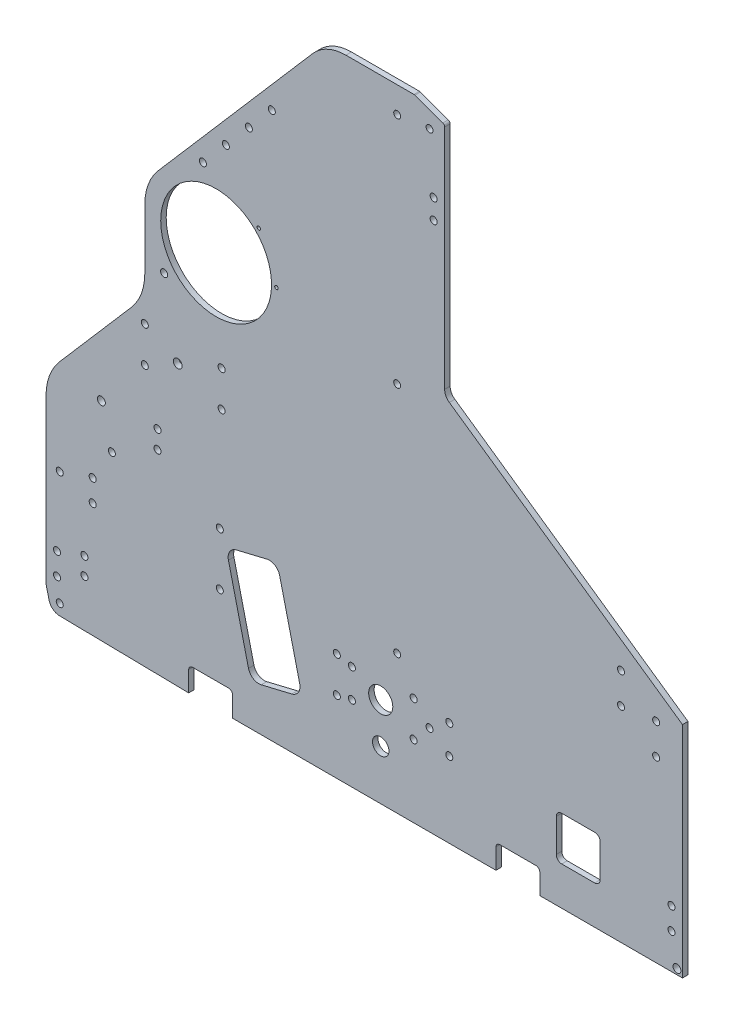
from build123d import *

# Parameters (mm, degrees)
SKETCH1_R           = 2.032
SKETCH1_R_2         = 2.54
SKETCH1_R_3         = 2
BOSS_EXTRUDE1_DEPTH = 3.175
FILLET1_R           = 2.286
FILLET2_R           = 6.35
SKETCH2_R           = 2.032
CUT_EXTRUDE1_DEPTH  = 505.524983177
FILLET3_R           = 1.5875
SKETCH3_R           = 2.032
SKETCH3_R_2         = 2.286
SKETCH3_R_3         = 1.016
CUT_EXTRUDE2_DEPTH  = 505.524983177
SKETCH4_R           = 2.032
SKETCH4_R_2         = 6.985
SKETCH4_R_3         = 4.7625
CUT_EXTRUDE3_DEPTH  = 505.524983177
SKETCH5_R           = 32.0675
SKETCH5_R_2         = 2.286
CUT_EXTRUDE5_DEPTH  = 540.282512255
FILLET4_R           = 31.75
CUT_EXTRUDE6_DEPTH  = 505.524983177
SKETCH7_R           = 2.032
CUT_EXTRUDE7_DEPTH  = 2.54
FILLET5_R           = 25.4


with BuildPart() as part:
    # Sketch1 → Boss-Extrude1 (new body)
    with BuildSketch(Plane.XY):
        with BuildLine():
            Line((7.829508682, -19.049081656), (82.55, -20.32))
            Line((82.55, -20.32), (82.55, -6.35))
            Line((82.55, -6.35), (107.95, -6.35))
            Line((107.95, -6.35), (107.95, -20.32))
            Line((107.95, -20.32), (260.35, -20.32))
            Line((260.35, -20.32), (260.35, -6.35))
            Line((260.35, -6.35), (285.75, -6.35))
            Line((285.75, -6.35), (285.75, -20.32))
            Line((285.75, -20.32), (368.3, -20.32))
            Line((368.3, -20.32), (368.3, 106.68))
            Line((368.3, 106.68), (230.66375, 202.565))
            Line((230.66375, 202.565), (230.66375, 338.455))
            Line((230.66375, 338.455), (213.19998, 344.805))
            Line((213.19998, 344.805), (203.2, 344.805))
            Line((203.2, 344.805), (161.925, 344.805))
            Line((161.925, 344.805), (52.720122664, 218.469945827))
            ThreePointArc((52.720122664, 218.469945827), (52.803835479, 218.142145922), (52.832, 217.805))
            ThreePointArc((52.832, 217.805), (52.095493096, 216.239521914), (50.419872403, 215.808871996))
            Line((50.419872403, 215.808871996), (0, 157.48))
            Line((0, 157.48), (0, 0))
            Line((0, 0), (0, -6.35))
            ThreePointArc((0, -6.35), (0.047577015, -7.125863724), (0.189595124, -7.890101219))
            Line((0.189595124, -7.890101219), (1.777095124, -14.240101219))
            ThreePointArc((1.777095124, -14.240101219), (3.987212552, -17.671692778), (7.829508682, -19.049081656))
        make_face()
        with Locations((7.9375, -12.7)):
            Circle(SKETCH1_R, mode=Mode.SUBTRACT)
        with Locations((6.35, 0)):
            Circle(SKETCH1_R, mode=Mode.SUBTRACT)
        with Locations((6.35, 12.7)):
            Circle(SKETCH1_R, mode=Mode.SUBTRACT)
        with Locations((38.1, 78.105)):
            Circle(SKETCH1_R, mode=Mode.SUBTRACT)
        with Locations((57.15, 131.28625)):
            Circle(SKETCH1_R, mode=Mode.SUBTRACT)
        with Locations((57.15, 151.92375)):
            Circle(SKETCH1_R, mode=Mode.SUBTRACT)
        with Locations((76.2, 141.605)):
            Circle(SKETCH1_R_2, mode=Mode.SUBTRACT)
        with Locations((101.6, 131.28625)):
            Circle(SKETCH1_R, mode=Mode.SUBTRACT)
        with Locations((101.6, 151.92375)):
            Circle(SKETCH1_R, mode=Mode.SUBTRACT)
        with Locations((203.2, 59.805)):
            Circle(SKETCH1_R_3, mode=Mode.SUBTRACT)
        with Locations((361.95, 0)):
            Circle(SKETCH1_R, mode=Mode.SUBTRACT)
        with Locations((361.95, 12.7)):
            Circle(SKETCH1_R, mode=Mode.SUBTRACT)
        with Locations((353.06, 82.955052336)):
            Circle(SKETCH1_R, mode=Mode.SUBTRACT)
        with Locations((332.74, 98.195052336)):
            Circle(SKETCH1_R, mode=Mode.SUBTRACT)
        with Locations((332.74, 115.975052336)):
            Circle(SKETCH1_R, mode=Mode.SUBTRACT)
        with Locations((353.06, 100.735052336)):
            Circle(SKETCH1_R, mode=Mode.SUBTRACT)
        with Locations((68.326, 182.923674932)):
            Circle(SKETCH1_R, mode=Mode.SUBTRACT)
        with Locations((76.2, 217.805)):
            Circle(SKETCH1_R, mode=Mode.SUBTRACT)
        with Locations((90.779500502, 249.682)):
            Circle(SKETCH1_R, mode=Mode.SUBTRACT)
        with Locations((104.067838673, 265.054783374)):
            Circle(SKETCH1_R, mode=Mode.SUBTRACT)
        with Locations((117.356176844, 280.427566748)):
            Circle(SKETCH1_R, mode=Mode.SUBTRACT)
        with Locations((130.644515014, 295.800350122)):
            Circle(SKETCH1_R, mode=Mode.SUBTRACT)
        with Locations((203.2, 194.805)):
            Circle(SKETCH1_R_3, mode=Mode.SUBTRACT)
        with Locations((224.31375, 287.401)):
            Circle(SKETCH1_R, mode=Mode.SUBTRACT)
        with Locations((224.31375, 298.831)):
            Circle(SKETCH1_R, mode=Mode.SUBTRACT)
        with Locations((203.2, 329.805)):
            Circle(SKETCH1_R_3, mode=Mode.SUBTRACT)
        with Locations((221.931865, 332.105)):
            Circle(SKETCH1_R_3, mode=Mode.SUBTRACT)
    extrude(amount=BOSS_EXTRUDE1_DEPTH)

    # Fillet1
    fillet1_edges = [part.edges().sort_by_distance(p)[0] for p in [
        (285.75, -6.35, 1.5875),
        (107.95, -6.35, 1.5875),
        (260.35, -6.35, 1.5875),
        (82.55, -6.35, 1.5875),
    ]]
    fillet(fillet1_edges, radius=FILLET1_R)

    # Fillet2
    fillet2_edges = [part.edges().sort_by_distance(p)[0] for p in [
        (230.66375, 202.565, 1.5875),
    ]]
    fillet(fillet2_edges, radius=FILLET2_R)

    # Sketch2 → Cut-Extrude1 (cut, through all)
    with BuildSketch(Plane(origin=(0, 0, 0), x_dir=(-1, 0, 0), z_dir=(0, 0, -1))):
        with Locations((-100.552770272, 71.086035298)):
            Circle(SKETCH2_R)
        with Locations((-100.552770272, 40.606035298)):
            Circle(SKETCH2_R)
        with Locations((-22.225, 18.202541089)):
            Circle(SKETCH2_R)
        with Locations((-22.225, 8.042541089)):
            Circle(SKETCH2_R)
    extrude(amount=-CUT_EXTRUDE1_DEPTH, mode=Mode.SUBTRACT)

    # Fillet3
    fillet3_edges = [part.edges().sort_by_distance(p)[0] for p in [
        (230.66375, 338.455, 1.5875),
        (213.19998, 344.805, 1.5875),
    ]]
    fillet(fillet3_edges, radius=FILLET3_R)

    # Sketch3 → Cut-Extrude2 (cut, through all)
    with BuildSketch(Plane.XY.offset(3.175)):
        with BuildLine():
            Line((127.789350211, 69.359774106), (110.090750339, 65.117184968))
            ThreePointArc((110.090750339, 65.117184968), (106.287939856, 62.356288953), (105.55119507, 57.715047577))
            Line((105.55119507, 57.715047577), (117.160037875, 9.287010566))
            ThreePointArc((117.160037875, 9.287010566), (119.92093389, 5.484200083), (124.562175266, 4.747455297))
            Line((124.562175266, 4.747455297), (142.260775137, 8.990044434))
            ThreePointArc((142.260775137, 8.990044434), (146.063585621, 11.75094045), (146.800330407, 16.392181825))
            Line((146.800330407, 16.392181825), (135.191487602, 64.820218836))
            ThreePointArc((135.191487602, 64.820218836), (132.430591586, 68.62302932), (127.789350211, 69.359774106))
        make_face()
        with Locations((26.987500002, 46.953113935)):
            Circle(SKETCH3_R)
        with Locations((26.987500002, 59.653113935)):
            Circle(SKETCH3_R)
        with Locations((7.937500002, 53.303113935)):
            Circle(SKETCH3_R)
        with Locations((32.030600738, 100.810868776)):
            Circle(SKETCH3_R_2)
        with Locations((64.525942114, 102.94048958)):
            Circle(SKETCH3_R)
        with Locations((64.525942114, 92.525786339)):
            Circle(SKETCH3_R)
        with Locations((133.35, 208.228121768)):
            Circle(SKETCH3_R_3)
        with Locations((123.120704333, 232.923826101)):
            Circle(SKETCH3_R_3)
    extrude(amount=-CUT_EXTRUDE2_DEPTH, mode=Mode.SUBTRACT)

    # Sketch4 → Cut-Extrude3 (cut, through all)
    with BuildSketch(Plane.XY.offset(3.175)):
        with Locations((168.275, 42.06875)):
            Circle(SKETCH4_R)
        with Locations((212.725, 42.06875)):
            Circle(SKETCH4_R)
        with Locations((212.725, 21.43125)):
            Circle(SKETCH4_R)
        with Locations((168.275, 21.43125)):
            Circle(SKETCH4_R)
        with Locations((193.675, 31.75)):
            Circle(SKETCH4_R_2)
        with Locations((177.00498, 40.0431)):
            Circle(SKETCH4_R)
        with Locations((177.00498, 23.4569)):
            Circle(SKETCH4_R)
        with Locations((193.675, 8.466666658)):
            Circle(SKETCH4_R_3)
        with Locations((221.931865, 31.75)):
            Circle(SKETCH4_R)
        with Locations((233.36123, 23.4569)):
            Circle(SKETCH4_R)
        with Locations((233.36123, 40.0431)):
            Circle(SKETCH4_R)
    extrude(amount=-CUT_EXTRUDE3_DEPTH, mode=Mode.SUBTRACT)

    # Sketch5 → Cut-Extrude5 (cut, through all)
    with BuildSketch(Plane(origin=(0, 0, -187.324999998), x_dir=(-1, 0, 0), z_dir=(0, 0, -1))):
        Polygon((0, 157.48), (-57.15, 223.594705882), (-57.15, 165.333696112), (0, 99.218990229), align=None)
        with Locations((-98.425, 208.228121768)):
            Circle(SKETCH5_R)
        with Locations((-365.124993903, -17.144956474)):
            Circle(SKETCH5_R_2)
    extrude(amount=-CUT_EXTRUDE5_DEPTH, mode=Mode.SUBTRACT)

    # Fillet4
    fillet4_edges = [part.edges().sort_by_distance(p)[0] for p in [
        (0, 99.218990229, 1.5875),
        (57.15, 165.333696112, 1.5875),
        (57.15, 223.594705882, 1.5875),
    ]]
    fillet(fillet4_edges, radius=FILLET4_R)

    # Sketch6 → Cut-Extrude6 (cut, through all)
    with BuildSketch(Plane.XY.offset(3.175)):
        with BuildLine():
            Line((298.45, 27.305), (317.5, 27.305))
            ThreePointArc((317.5, 27.305), (319.74506403, 26.37506403), (320.675, 24.13))
            Line((320.675, 24.13), (320.675, 5.08))
            ThreePointArc((320.675, 5.08), (319.74506403, 2.83493597), (317.5, 1.905))
            Line((317.5, 1.905), (298.45, 1.905))
            ThreePointArc((298.45, 1.905), (296.20493597, 2.83493597), (295.275, 5.08))
            Line((295.275, 5.08), (295.275, 24.13))
            ThreePointArc((295.275, 24.13), (296.20493597, 26.37506403), (298.45, 27.305))
        make_face()
    extrude(amount=-CUT_EXTRUDE6_DEPTH, mode=Mode.SUBTRACT)

    # Sketch7 → Cut-Extrude7 (cut)
    with BuildSketch(Plane(origin=(0, 0, 0), x_dir=(-1, 0, 0), z_dir=(0, 0, -1))):
        with Locations((-215.9, 306.704999829)):
            Circle(SKETCH7_R)
        with Locations((-203.2, 306.704999829)):
            Circle(SKETCH7_R)
        with Locations((-190.5, 306.70499983)):
            Circle(SKETCH7_R)
        with Locations((-177.8, 306.70499983)):
            Circle(SKETCH7_R)
        with Locations((-215.9, 255.904999829)):
            Circle(SKETCH7_R)
        with Locations((-203.2, 255.904999829)):
            Circle(SKETCH7_R)
        with Locations((-190.5, 255.90499983)):
            Circle(SKETCH7_R)
        with Locations((-177.8, 255.90499983)):
            Circle(SKETCH7_R)
    extrude(amount=-CUT_EXTRUDE7_DEPTH, mode=Mode.SUBTRACT)

    # Fillet5
    fillet5_edges = [part.edges().sort_by_distance(p)[0] for p in [
        (161.925, 344.805, 1.5875),
    ]]
    fillet(fillet5_edges, radius=FILLET5_R)


solid = part.part
